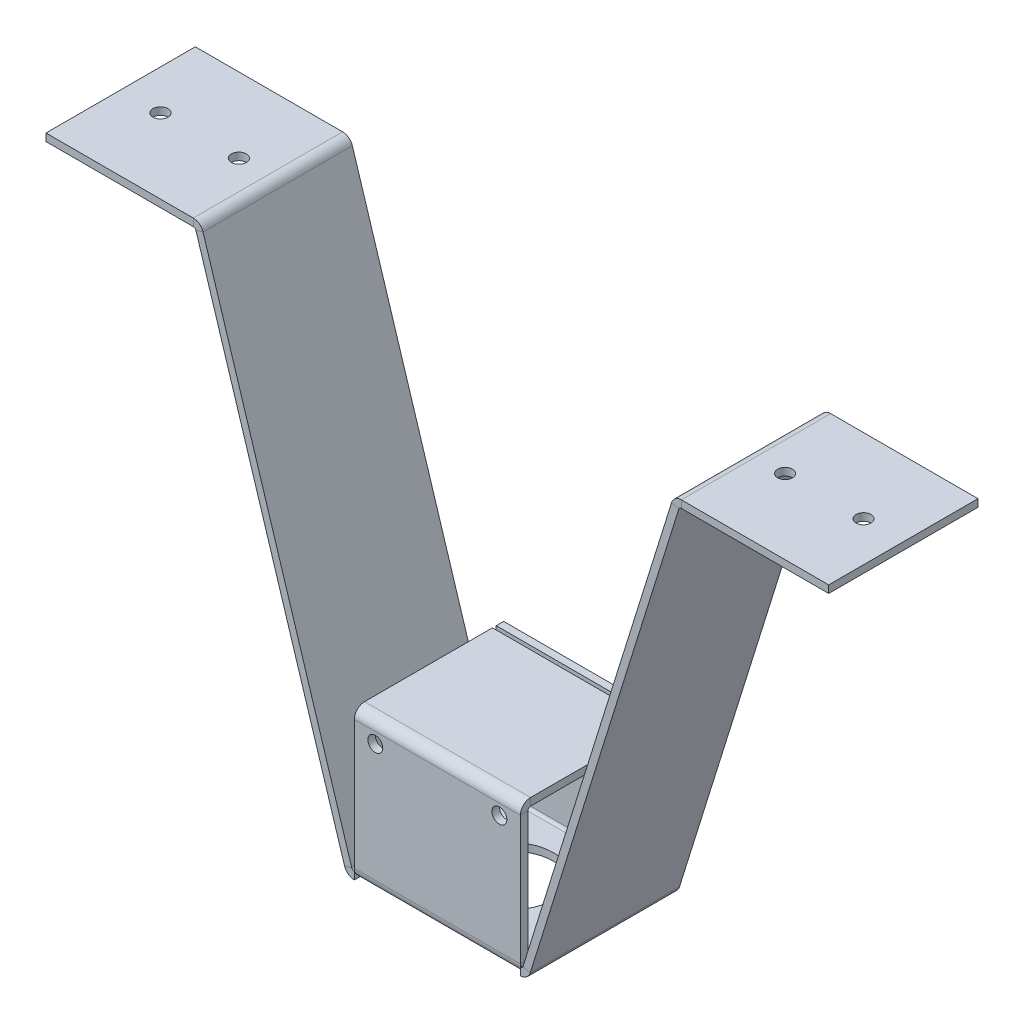
from build123d import *

# Parameters (mm, degrees)
BASE_FLANGE1_DEPTH           = 40
EDGE_FLANGE1_STRIP_W         = 9.4732
EDGE_FLANGE1_STRIP_H         = 2
EDGE_FLANGE1_STRIP_CUT_DEPTH = 44.47497737
EDGE_FLANGE1_DEPTH           = 44.47497737
EDGE_FLANGE2_STRIP_W         = 9.4732
EDGE_FLANGE2_STRIP_H         = 2
EDGE_FLANGE2_STRIP_CUT_DEPTH = 44.47497737
EDGE_FLANGE2_DEPTH           = 44.47497737
EDGE_FLANGE3_STRIP_W         = 9.4732
EDGE_FLANGE3_STRIP_H         = 2
EDGE_FLANGE3_STRIP_CUT_DEPTH = 44.47497737
EDGE_FLANGE3_DEPTH           = 44.47497737
CUT_EXTRUDE1_REACH           = 175.247
SKETCH28_R                   = 11
SKETCH28_R_2                 = 2
SKETCH29_R                   = 2
CUT_EXTRUDE2_DEPTH           = 174.246707232


# Sheet-metal steps are written as plain solids
with BuildPart() as part:
    # Sketch1 → Base-Flange1 (new body)
    with BuildSketch(Plane.XY):
        with BuildLine():
            Line((104.835211483, 130), (65.376911342, 130))
            ThreePointArc((65.376911342, 130), (64.940513549, 129.856810925), (64.67378015, 129.482913293))
            Line((64.67378015, 129.482913293), (24.849746113, 1.921069076))
            ThreePointArc((24.849746113, 1.921069076), (23.858784098, 0.531972879), (22.237488685, 0))
            Line((22.237488685, 0), (-22.237488685, 0))
            ThreePointArc((-22.237488685, 0), (-23.858784098, 0.531972879), (-24.849746113, 1.921069076))
            Line((-24.849746113, 1.921069076), (-64.67378015, 129.482913293))
            ThreePointArc((-64.67378015, 129.482913293), (-64.940513549, 129.856810925), (-65.376911342, 130))
            Line((-65.376911342, 130), (-104.835211483, 130))
            Line((-104.835211483, 130), (-104.835211483, 132))
            Line((-104.835211483, 132), (-65.376911342, 132))
            ThreePointArc((-65.376911342, 132), (-63.755615929, 131.468027121), (-62.764653914, 130.078930924))
            Line((-62.764653914, 130.078930924), (-22.940619877, 2.517086707))
            ThreePointArc((-22.940619877, 2.517086707), (-22.673886478, 2.143189075), (-22.237488685, 2))
            Line((-22.237488685, 2), (22.237488685, 2))
            ThreePointArc((22.237488685, 2), (22.673886478, 2.143189075), (22.940619877, 2.517086707))
            Line((22.940619877, 2.517086707), (62.764653914, 130.078930924))
            ThreePointArc((62.764653914, 130.078930924), (63.755615929, 131.468027121), (65.376911342, 132))
            Line((65.376911342, 132), (104.835211483, 132))
            Line((104.835211483, 132), (104.835211483, 130))
        make_face()
    extrude(amount=BASE_FLANGE1_DEPTH)

    # Edge-Flange1 strip (across the edge) → Edge-Flange1 strip cut (cut)
    with BuildSketch(Plane(origin=(22.237488685, 2, 0), x_dir=(0, 0, 1), z_dir=(-1, 0, 0))):
        with Locations((-2, -1)):
            Rectangle(EDGE_FLANGE1_STRIP_W, EDGE_FLANGE1_STRIP_H)
    extrude(amount=EDGE_FLANGE1_STRIP_CUT_DEPTH, mode=Mode.SUBTRACT)

    # Edge-Flange1 section (across the edge) → Edge-Flange1 (add)
    with BuildSketch(Plane(origin=(22.237488685, 2, 0), x_dir=(0, 0, 1), z_dir=(-1, 0, 0))):
        with BuildLine():
            Line((0, 0.7366), (0, 38))
            Line((0, 38), (2, 38))
            Line((2, 38), (2, 0.7366))
            ThreePointArc((2, 0.7366), (2.215745145, 0.215745145), (2.7366, 0))
            Line((2.7366, 0), (2.7366, -2))
            ThreePointArc((2.7366, -2), (0.801531583, -1.198468417), (0, 0.7366))
        make_face()
    extrude(amount=EDGE_FLANGE1_DEPTH)

    # Edge-Flange2 strip (across the edge) → Edge-Flange2 strip cut (cut)
    with BuildSketch(Plane(origin=(-22.237488685, 2, 40), x_dir=(0, 0, -1), z_dir=(1, 0, 0))):
        with Locations((-2, -1)):
            Rectangle(EDGE_FLANGE2_STRIP_W, EDGE_FLANGE2_STRIP_H)
    extrude(amount=EDGE_FLANGE2_STRIP_CUT_DEPTH, mode=Mode.SUBTRACT)

    # Edge-Flange2 section (across the edge) → Edge-Flange2 (add)
    with BuildSketch(Plane(origin=(-22.237488685, 2, 40), x_dir=(0, 0, -1), z_dir=(1, 0, 0))):
        with BuildLine():
            Line((0, 0.7366), (0, 38))
            Line((0, 38), (2, 38))
            Line((2, 38), (2, 0.7366))
            ThreePointArc((2, 0.7366), (2.215745145, 0.215745145), (2.7366, 0))
            Line((2.7366, 0), (2.7366, -2))
            ThreePointArc((2.7366, -2), (0.801531583, -1.198468417), (0, 0.7366))
        make_face()
    extrude(amount=EDGE_FLANGE2_DEPTH)

    # Edge-Flange3 strip (across the edge) → Edge-Flange3 strip cut (cut)
    with BuildSketch(Plane(origin=(-22.237488685, 40, 38), x_dir=(0, -1, 0), z_dir=(1, 0, 0))):
        with Locations((-2, -1)):
            Rectangle(EDGE_FLANGE3_STRIP_W, EDGE_FLANGE3_STRIP_H)
    extrude(amount=EDGE_FLANGE3_STRIP_CUT_DEPTH, mode=Mode.SUBTRACT)

    # Edge-Flange3 section (across the edge) → Edge-Flange3 (add)
    with BuildSketch(Plane(origin=(-22.237488685, 40, 38), x_dir=(0, -1, 0), z_dir=(1, 0, 0))):
        with BuildLine():
            Line((0, 0.7366), (0, 35))
            Line((0, 35), (2, 35))
            Line((2, 35), (2, 0.7366))
            ThreePointArc((2, 0.7366), (2.215745145, 0.215745145), (2.7366, 0))
            Line((2.7366, 0), (2.7366, -2))
            ThreePointArc((2.7366, -2), (0.801531583, -1.198468417), (0, 0.7366))
        make_face()
    extrude(amount=EDGE_FLANGE3_DEPTH)

    # Sketch28 → Cut-Extrude1 (cut, up to next)
    with BuildSketch(Plane.XZ, mode=Mode.PRIVATE) as cut_extrude1_sk1:
        with Locations(Location((0, 20, 0), (0, 0, 270))):
            Circle(SKETCH28_R)
    cut_extrude1_tool1 = extrude(cut_extrude1_sk1.sketch, amount=-CUT_EXTRUDE1_REACH, mode=Mode.PRIVATE) & part.part
    # Sketch28 → Cut-Extrude1 (cut, up to next)
    with BuildSketch(Plane.XZ, mode=Mode.PRIVATE) as cut_extrude1_sk2:
        with Locations((73.154329826, 20)):
            Circle(SKETCH28_R_2)
    cut_extrude1_tool2 = extrude(cut_extrude1_sk2.sketch, amount=-CUT_EXTRUDE1_REACH, mode=Mode.PRIVATE) & part.part
    # Sketch28 → Cut-Extrude1 (cut, up to next)
    with BuildSketch(Plane.XZ, mode=Mode.PRIVATE) as cut_extrude1_sk3:
        with Locations((94.167570852, 20)):
            Circle(SKETCH28_R_2)
    cut_extrude1_tool3 = extrude(cut_extrude1_sk3.sketch, amount=-CUT_EXTRUDE1_REACH, mode=Mode.PRIVATE) & part.part
    # Sketch28 → Cut-Extrude1 (cut, up to next)
    with BuildSketch(Plane.XZ, mode=Mode.PRIVATE) as cut_extrude1_sk4:
        with Locations((-94.167570852, 20)):
            Circle(SKETCH28_R_2)
    cut_extrude1_tool4 = extrude(cut_extrude1_sk4.sketch, amount=-CUT_EXTRUDE1_REACH, mode=Mode.PRIVATE) & part.part
    # Sketch28 → Cut-Extrude1 (cut, up to next)
    with BuildSketch(Plane.XZ, mode=Mode.PRIVATE) as cut_extrude1_sk5:
        with Locations((-73.154329826, 20)):
            Circle(SKETCH28_R_2)
    cut_extrude1_tool5 = extrude(cut_extrude1_sk5.sketch, amount=-CUT_EXTRUDE1_REACH, mode=Mode.PRIVATE) & part.part
    add(cut_extrude1_tool1.solids().sort_by_distance((0, 0, 20))[0], mode=Mode.SUBTRACT)
    add(cut_extrude1_tool2.solids().sort_by_distance((73.15433, 0, 20))[0], mode=Mode.SUBTRACT)
    add(cut_extrude1_tool3.solids().sort_by_distance((94.167571, 0, 20))[0], mode=Mode.SUBTRACT)
    add(cut_extrude1_tool4.solids().sort_by_distance((-94.167571, 0, 20))[0], mode=Mode.SUBTRACT)
    add(cut_extrude1_tool5.solids().sort_by_distance((-73.15433, 0, 20))[0], mode=Mode.SUBTRACT)

    # Sketch29 → Cut-Extrude2 (cut, through all)
    with BuildSketch(Plane(origin=(0, 0, 0), x_dir=(-1, 0, 0), z_dir=(0, 0, -1))):
        with Locations(Location((-16.618744342, 34.381255658, 0), (0, 0, 90))):
            Circle(SKETCH29_R)
        with Locations(Location((16.618744342, 34.381255658, 0), (0, 0, 90))):
            Circle(SKETCH29_R)
    extrude(amount=-CUT_EXTRUDE2_DEPTH, mode=Mode.SUBTRACT)


solid = part.part
